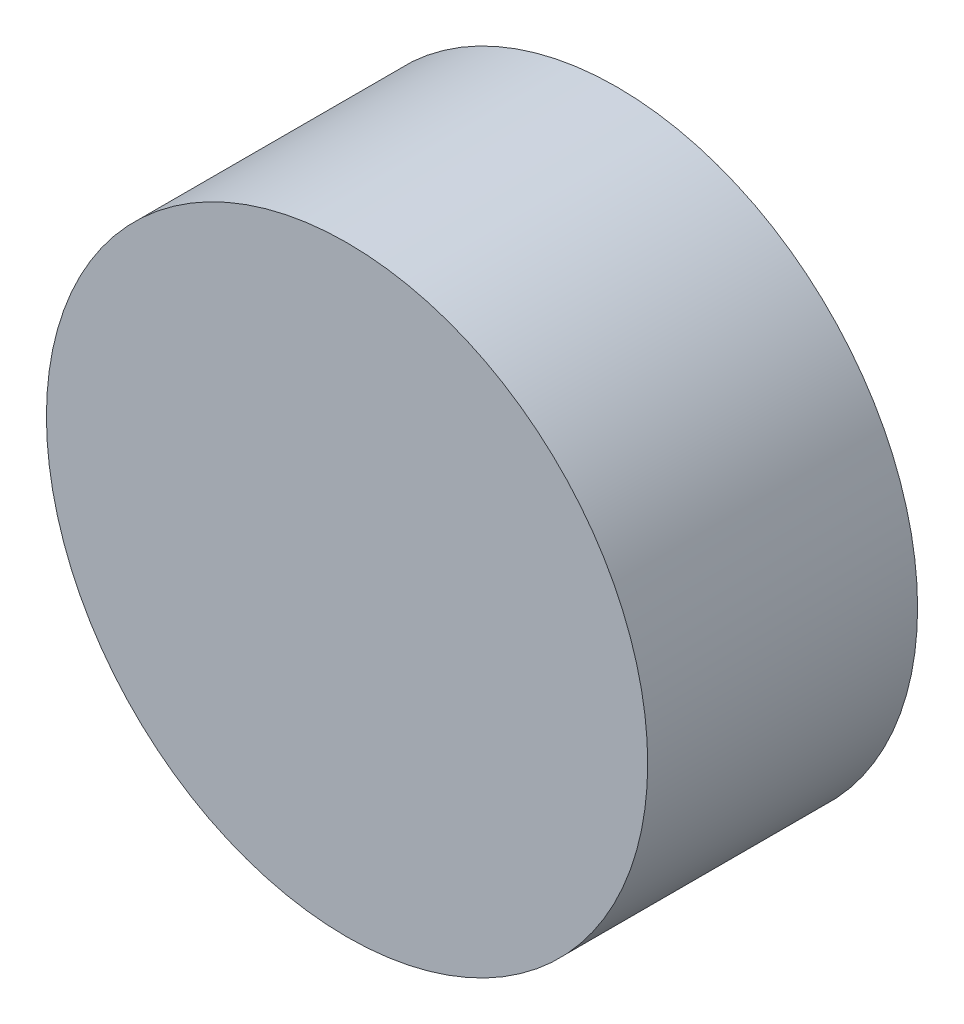
from build123d import *

# Parameters (mm, degrees)
SKETCH1_R           = 12.7
BOSS_EXTRUDE1_DEPTH = 11.4


with BuildPart() as part:
    # Sketch1 → Boss-Extrude1 (new body)
    with BuildSketch(Plane.XY):
        Circle(SKETCH1_R)
    extrude(amount=BOSS_EXTRUDE1_DEPTH)


solid = part.part
